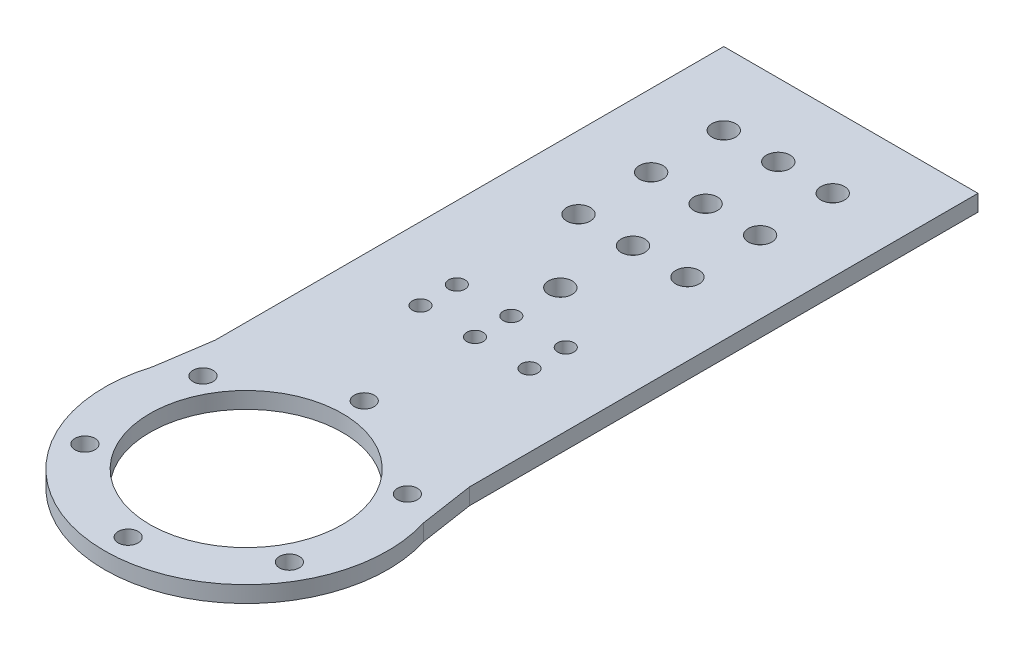
from build123d import *

# Parameters (mm, degrees)
SKETCH1_R            = 39
SKETCH1_R_2          = 26.5
BOSS_EXTRUDE1_DEPTH  = 2.25
SKETCH3_W            = 50
SKETCH3_H            = 51.5
BOSS_EXTRUDE2_DEPTH  = 2.25
BOSS_EXTRUDE4_DEPTH  = 2.25
SKETCH2_R            = 2.75
CUT_EXTRUDE1_DEPTH   = 172.021380242
CIRPATTERN1_COUNT    = 6
SKETCH5_R            = 2.25
CUT_EXTRUDE2_DEPTH   = 172.065776823
LPATTERN1_COUNT      = 2
LPATTERN1_PITCH      = 15
LPATTERN1_COUNT_DIR2 = 2
LPATTERN1_PITCH_DIR2 = 10
LPATTERN2_COUNT      = 2
LPATTERN2_PITCH      = 15
LPATTERN2_COUNT_DIR2 = 2
LPATTERN2_PITCH_DIR2 = 10
SKETCH7_R            = 3.25
CUT_EXTRUDE3_DEPTH   = 172.065776823
LPATTERN3_COUNT      = 3
LPATTERN3_PITCH      = 20
SKETCH8_R            = 3.25
CUT_EXTRUDE4_DEPTH   = 10
LPATTERN4_COUNT      = 4
LPATTERN4_PITCH      = 20


with BuildPart() as part:
    # Sketch1 → Boss-Extrude1 (new, symmetric)
    with BuildSketch(Plane(origin=(0, 0, 0), x_dir=(1, 0, 0), z_dir=(0, 1, 0))):
        Circle(SKETCH1_R)
        Circle(SKETCH1_R_2, mode=Mode.SUBTRACT)
    extrude(amount=BOSS_EXTRUDE1_DEPTH, both=True)

    # Sketch3 → Boss-Extrude2 (add, symmetric)
    with BuildSketch(Plane(origin=(0, 0, 0), x_dir=(1, 0, 0), z_dir=(0, 1, 0))):
        with Locations((0, 52.25)):
            Rectangle(SKETCH3_W, SKETCH3_H)
    extrude(amount=BOSS_EXTRUDE2_DEPTH, both=True)

    # Sketch6 → Boss-Extrude4 (add, symmetric)
    with BuildSketch(Plane(origin=(0, 0, 0), x_dir=(1, 0, 0), z_dir=(0, 1, 0))):
        Polygon((-35, 166.5), (-35, 26.5), (-39, 0), (-14.981514186, 26.5), (16.520833333, 26.5), (39, 0), (35, 26.5), (35, 166.5), align=None)
    extrude(amount=BOSS_EXTRUDE4_DEPTH, both=True)

    # Sketch2 → Cut-Extrude1 (cut, symmetric)
    with BuildSketch(Plane(origin=(0, 0, 0), x_dir=(1, 0, 0), z_dir=(0, 1, 0))):
        with Locations((0, 32.5)):
            Circle(SKETCH2_R)
    cut_extrude1 = extrude(amount=CUT_EXTRUDE1_DEPTH, both=True, mode=Mode.SUBTRACT)

    # CirPattern1: Cut-Extrude1 ×6 about axis
    cirpattern1_axis = Axis((0, 2.25, 0), (0, 1, 0))
    for i in range(1, CIRPATTERN1_COUNT):
        add(cut_extrude1.rotate(cirpattern1_axis, i * 360 / CIRPATTERN1_COUNT), mode=Mode.SUBTRACT)

    # Sketch5 → Cut-Extrude2 (cut, symmetric)
    with BuildSketch(Plane(origin=(0, 2.25, 0), x_dir=(1, 0, 0), z_dir=(0, 1, 0))):
        with Locations((0, 73)):
            Circle(SKETCH5_R)
    cut_extrude2 = extrude(amount=CUT_EXTRUDE2_DEPTH, both=True, mode=Mode.SUBTRACT)

    # LPattern1: Cut-Extrude2 2 × 2
    with Locations(*[(i * LPATTERN1_PITCH, 0, j * LPATTERN1_PITCH_DIR2) for i in range(LPATTERN1_COUNT) for j in range(LPATTERN1_COUNT_DIR2) if (i, j) != (0, 0)]):
        add(cut_extrude2, mode=Mode.SUBTRACT)

    # LPattern2: Cut-Extrude2 2 × 2
    with Locations(*[(-i * LPATTERN2_PITCH, 0, j * LPATTERN2_PITCH_DIR2) for i in range(LPATTERN2_COUNT) for j in range(LPATTERN2_COUNT_DIR2) if (i, j) != (0, 0)]):
        add(cut_extrude2, mode=Mode.SUBTRACT)

    # Sketch7 → Cut-Extrude3 (cut, symmetric)
    with BuildSketch(Plane(origin=(0, 2.25, 0), x_dir=(1, 0, 0), z_dir=(0, 1, 0))):
        with Locations((-15, 146.5)):
            Circle(SKETCH7_R)
        with Locations((15, 146.5)):
            Circle(SKETCH7_R)
    cut_extrude3 = extrude(amount=CUT_EXTRUDE3_DEPTH, both=True, mode=Mode.SUBTRACT)

    # LPattern3: Cut-Extrude3 ×3
    with Locations(*[(0, 0, i * LPATTERN3_PITCH) for i in range(1, LPATTERN3_COUNT)]):
        add(cut_extrude3, mode=Mode.SUBTRACT)

    # Sketch8 → Cut-Extrude4 (cut)
    with BuildSketch(Plane(origin=(0, 2.25, 0), x_dir=(1, 0, 0), z_dir=(0, 1, 0))):
        with Locations((0, 146.5)):
            Circle(SKETCH8_R)
    cut_extrude4 = extrude(amount=-CUT_EXTRUDE4_DEPTH, mode=Mode.SUBTRACT)

    # LPattern4: Cut-Extrude4 ×4
    with Locations(*[(0, 0, i * LPATTERN4_PITCH) for i in range(1, LPATTERN4_COUNT)]):
        add(cut_extrude4, mode=Mode.SUBTRACT)


solid = part.part
